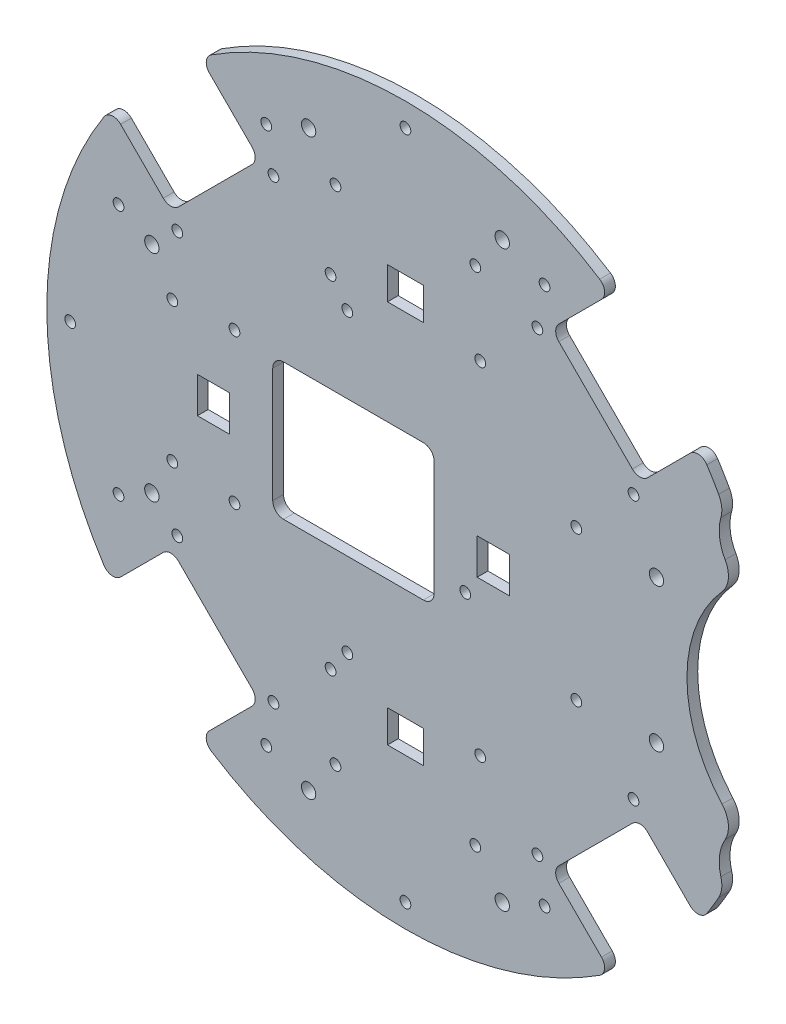
from build123d import *

# Parameters (mm, degrees)
CROQUIS1_R              = 100
SALIENTE_EXTRUIR1_DEPTH = 3
CORTAR_EXTRUIR1_START   = -3
CORTAR_EXTRUIR1_DEPTH   = 3
CORTAR_EXTRUIR6_DEPTH   = 10
CROQUIS12_R             = 1.5
CORTAR_EXTRUIR7_DEPTH   = 142.453172464
CROQUIS9_W              = 9
CROQUIS9_H              = 10
CROQUIS9_W_2            = 10
CROQUIS9_H_2            = 9
CORTAR_EXTRUIR5_DEPTH   = 10
CROQUIS13_R             = 2
CROQUIS13_R_2           = 1.5
CROQUIS13_W             = 45
CROQUIS13_H             = 38
CORTAR_EXTRUIR8_DEPTH   = 142.453172464
REDONDEO2_R             = 3
CROQUIS14_R             = 1.5
CORTAR_EXTRUIR9_DEPTH   = 142.453172464
CROQUIS15_R             = 1.5
CORTAR_EXTRUIR10_DEPTH  = 10
CROQUIS16_R             = 1.5
CROQUIS16_R_2           = 2
CORTAR_EXTRUIR11_DEPTH  = 10
CROQUIS17_R             = 12.5
CORTAR_EXTRUIR12_DEPTH  = 10
REDONDEO3_R             = 7


with BuildPart() as part:
    # Croquis1 → Saliente-Extruir1 (new body)
    with BuildSketch(Plane.XY):
        Circle(CROQUIS1_R)
    extrude(amount=SALIENTE_EXTRUIR1_DEPTH)

    # Croquis3 → Cortar-Extruir1 (cut)
    with BuildSketch(Plane.XY.offset(3).offset(CORTAR_EXTRUIR1_START)):
        with BuildLine():
            ThreePointArc((94.900641026, 31.525677359), (78.5, 0), (94.900641026, -31.525677359))
            ThreePointArc((94.900641026, -31.525677359), (100, 0), (94.900641026, 31.525677359))
        make_face()
    extrude(amount=CORTAR_EXTRUIR1_DEPTH, mode=Mode.SUBTRACT)

    # Croquis5 → Cortar-Extruir6 (cut)
    with BuildSketch(Plane.XY.offset(3)):
        Polygon((-58.336309448, -83.085046789), (-83.085046789, -58.336309448), (-65.40737726, -40.658639918), (-40.658639918, -65.40737726), align=None)
        Polygon((-83.085046789, 58.336309448), (-58.336309448, 83.085046789), (-40.658639918, 65.40737726), (-65.40737726, 40.658639918), align=None)
        Polygon((58.336309448, -83.085046789), (83.085046789, -58.336309448), (65.40737726, -40.658639918), (40.658639918, -65.40737726), align=None)
        Polygon((58.336309448, 83.085046789), (83.085046789, 58.336309448), (65.40737726, 40.658639918), (40.658639918, 65.40737726), align=None)
    extrude(amount=-CORTAR_EXTRUIR6_DEPTH, mode=Mode.SUBTRACT)

    # Croquis12 → Cortar-Extruir7 (cut, through all)
    with BuildSketch(Plane.XY.offset(3)):
        with Locations((-63.604254904, -36.804908024)):
            Circle(CROQUIS12_R)
        with Locations((-36.804907897, -63.604255031)):
            Circle(CROQUIS12_R)
        with Locations((-47.666068056, -20.866721176)):
            Circle(CROQUIS12_R)
        with Locations((-20.866721049, -47.666068183)):
            Circle(CROQUIS12_R)
        with Locations((47.666068183, 20.866721049)):
            Circle(CROQUIS12_R)
        with Locations((20.866721176, 47.666068056)):
            Circle(CROQUIS12_R)
        with Locations((63.604255031, 36.804907897)):
            Circle(CROQUIS12_R)
        with Locations((36.804908024, 63.604254904)):
            Circle(CROQUIS12_R)
        with Locations((20.866721325, -47.666067908)):
            Circle(CROQUIS12_R)
        with Locations((47.666068332, -20.866720901)):
            Circle(CROQUIS12_R)
        with Locations((63.60425518, -36.804907749)):
            Circle(CROQUIS12_R)
        with Locations((36.804908173, -63.604254756)):
            Circle(CROQUIS12_R)
        with Locations((-63.604254756, 36.804908173)):
            Circle(CROQUIS12_R)
        with Locations((-36.804907749, 63.60425518)):
            Circle(CROQUIS12_R)
        with Locations((-20.866720901, 47.666068332)):
            Circle(CROQUIS12_R)
        with Locations((-47.666067908, 20.866721325)):
            Circle(CROQUIS12_R)
    extrude(amount=-CORTAR_EXTRUIR7_DEPTH, mode=Mode.SUBTRACT)

    # Croquis9 → Cortar-Extruir5 (cut)
    with BuildSketch(Plane.XY.offset(3)):
        with Locations((24.5, 0)):
            Rectangle(CROQUIS9_W, CROQUIS9_H)
        with Locations((0, -53.5)):
            Rectangle(CROQUIS9_W_2, CROQUIS9_H_2)
        with Locations((-53.5, 0)):
            Rectangle(CROQUIS9_W, CROQUIS9_H)
        with Locations((0, 53.5)):
            Rectangle(CROQUIS9_W_2, CROQUIS9_H_2)
    extrude(amount=-CORTAR_EXTRUIR5_DEPTH, mode=Mode.SUBTRACT)

    # Croquis13 → Cortar-Extruir8 (cut, through all)
    with BuildSketch(Plane.XY.offset(3)):
        with Locations((-70.710287698, 30)):
            Circle(CROQUIS13_R)
        with Locations((-70.709712289, -30)):
            Circle(CROQUIS13_R)
        with Locations((0, 93.47)):
            Circle(CROQUIS13_R_2)
        with Locations((70, -20)):
            Circle(CROQUIS13_R)
        with Locations((70, 20)):
            Circle(CROQUIS13_R)
        with Locations((0, -93.47)):
            Circle(CROQUIS13_R_2)
        with Locations((-93.47, 0)):
            Circle(CROQUIS13_R_2)
        with Locations((-14.5, 1)):
            Rectangle(CROQUIS13_W, CROQUIS13_H)
    extrude(amount=-CORTAR_EXTRUIR8_DEPTH, mode=Mode.SUBTRACT)

    # Redondeo2
    redondeo2_edges = [part.edges().sort_by_distance(p)[0] for p in [
        (-81.993870249, 57.245132907, 1.5),
        (-65.40737726, 40.658639918, 1.5),
        (-40.658639918, 65.40737726, 1.5),
        (-57.245132907, 81.993870249, 1.5),
        (65.40737726, 40.658639918, 1.5),
        (40.658639918, 65.40737726, 1.5),
        (57.245132907, 81.993870249, 1.5),
        (81.993870249, 57.245132907, 1.5),
        (65.40737726, -40.658639918, 1.5),
        (40.658639918, -65.40737726, 1.5),
        (81.993870249, -57.245132907, 1.5),
        (57.245132907, -81.993870249, 1.5),
        (-65.40737726, -40.658639918, 1.5),
        (-81.993870249, -57.245132907, 1.5),
        (-57.245132907, -81.993870249, 1.5),
        (-40.658639918, -65.40737726, 1.5),
        (8, -18, 1.5),
        (8, 20, 1.5),
        (-37, -18, 1.5),
        (-37, 20, 1.5),
    ]]
    fillet(redondeo2_edges, radius=REDONDEO2_R)

    # Croquis14 → Cortar-Extruir9 (cut, through all)
    with BuildSketch(Plane.XY.offset(3)):
        with Locations((38.803203871, -75)):
            Circle(CROQUIS14_R)
        with Locations((-80, -35)):
            Circle(CROQUIS14_R)
        with Locations((-38.796796129, -75)):
            Circle(CROQUIS14_R)
        with Locations((-80, 35)):
            Circle(CROQUIS14_R)
        with Locations((-38.803203871, 75)):
            Circle(CROQUIS14_R)
        with Locations((38.796796129, 75)):
            Circle(CROQUIS14_R)
    extrude(amount=-CORTAR_EXTRUIR9_DEPTH, mode=Mode.SUBTRACT)

    # Croquis15 → Cortar-Extruir10 (cut)
    with BuildSketch(Plane(origin=(0, 0, 0), x_dir=(-1, 0, 0), z_dir=(0, 0, -1))):
        with Locations((16.19, 41.30805)):
            Circle(CROQUIS15_R)
        with Locations((16.19, -41.31815)):
            Circle(CROQUIS15_R)
        with Locations((-16.705, -10.31795)):
            Circle(CROQUIS15_R)
    extrude(amount=-CORTAR_EXTRUIR10_DEPTH, mode=Mode.SUBTRACT)

    # Croquis16 → Cortar-Extruir11 (cut)
    with BuildSketch(Plane(origin=(0, 0, 0), x_dir=(-1, 0, 0), z_dir=(0, 0, -1))):
        with Locations((-19.5, 70)):
            Circle(CROQUIS16_R)
        with Locations((19.5, 70)):
            Circle(CROQUIS16_R)
        with Locations((19.5, -70)):
            Circle(CROQUIS16_R)
        with Locations((-19.5, -70)):
            Circle(CROQUIS16_R)
        with Locations((65, 19.5)):
            Circle(CROQUIS16_R)
        with Locations((65, -19.5)):
            Circle(CROQUIS16_R)
        with Locations((-27, 80)):
            Circle(CROQUIS16_R_2)
        with Locations((27, 80)):
            Circle(CROQUIS16_R_2)
        with Locations((27, -80)):
            Circle(CROQUIS16_R_2)
        with Locations((-27, -80)):
            Circle(CROQUIS16_R_2)
    extrude(amount=-CORTAR_EXTRUIR11_DEPTH, mode=Mode.SUBTRACT)

    # Croquis17 → Cortar-Extruir12 (cut)
    with BuildSketch(Plane(origin=(0, 0, 0), x_dir=(-1, 0, 0), z_dir=(0, 0, -1))):
        with Locations((-100, 40)):
            Circle(CROQUIS17_R)
        with Locations((-100, -40)):
            Circle(CROQUIS17_R)
    extrude(amount=-CORTAR_EXTRUIR12_DEPTH, mode=Mode.SUBTRACT)

    # Redondeo3
    redondeo3_edges = [part.edges().sort_by_distance(p)[0] for p in [
        (88.911031532, -45.769296171, 1.5),
        (92.693955086, -29.857430912, 1.5),
        (88.911031532, 45.769296171, 1.5),
        (92.693955086, 29.857430912, 1.5),
    ]]
    fillet(redondeo3_edges, radius=REDONDEO3_R)


solid = part.part
